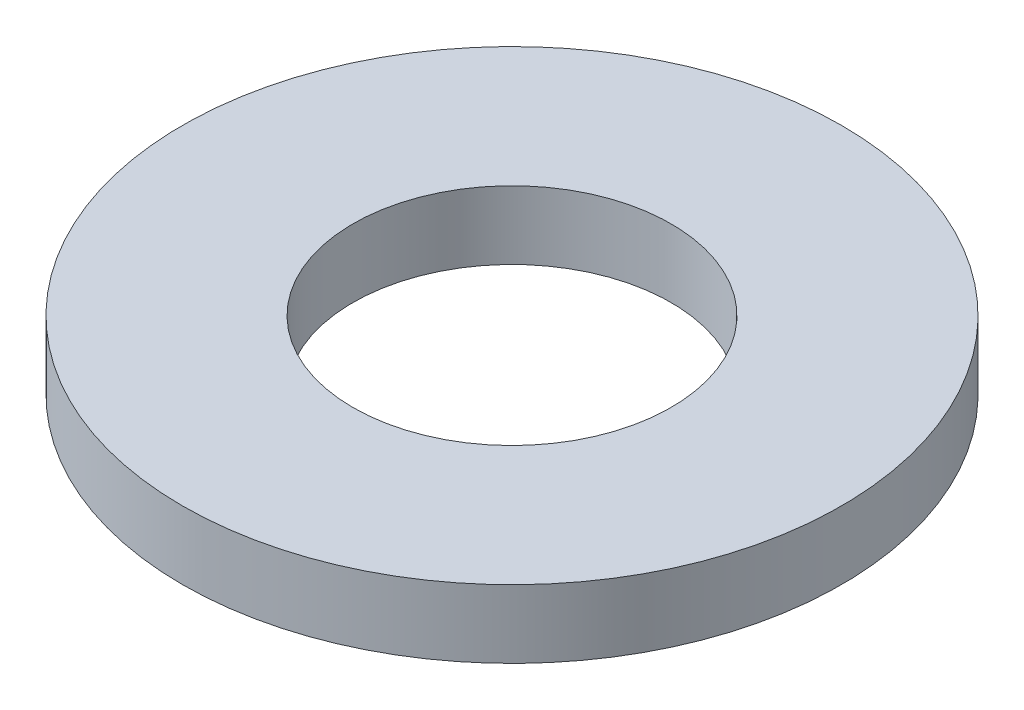
from build123d import *

# Parameters (mm, degrees)
SKETCH1_R           = 72.5
BOSS_EXTRUDE1_DEPTH = 15
SKETCH2_R           = 35
CUT_EXTRUDE1_DEPTH  = 104.62190888


with BuildPart() as part:
    # Sketch1 → Boss-Extrude1 (new body)
    with BuildSketch(Plane(origin=(0, 0, 0), x_dir=(1, 0, 0), z_dir=(0, 1, 0))):
        Circle(SKETCH1_R)
    extrude(amount=BOSS_EXTRUDE1_DEPTH)

    # Sketch2 → Cut-Extrude1 (cut, through all)
    with BuildSketch(Plane(origin=(0, 0, 0), x_dir=(1, 0, 0), z_dir=(0, 1, 0))):
        Circle(SKETCH2_R)
    extrude(amount=CUT_EXTRUDE1_DEPTH, mode=Mode.SUBTRACT)


solid = part.part
